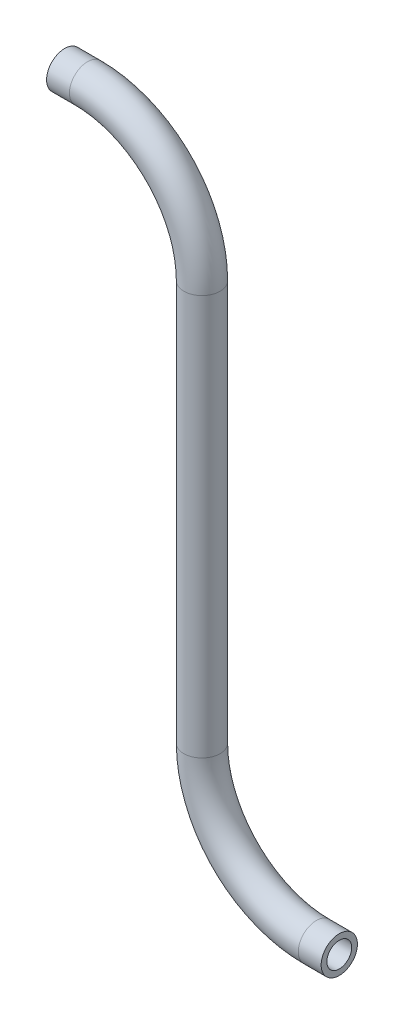
from build123d import *

# Parameters (mm, degrees)
SWEEP_SOTTILE1_PROFILE_R   = 1.585
SWEEP_SOTTILE1_PROFILE_R_2 = 1.085


with BuildPart() as part:
    # Sweep-Sottile1: sweep along a path in Schizzo1
    with BuildLine(Plane.XY) as sweep_sottile1_path:
        Line((-12, 55), (-10, 55))
        ThreePointArc((-10, 55), (-2.928932188, 52.071067812), (0, 45))
        Line((0, 45), (0, 10))
        ThreePointArc((0, 10), (2.928932188, 2.928932188), (10, 0))
        Line((10, 0), (12, 0))
    # Sweep-Sottile1 profile (on start of the path) → Sweep-Sottile1 (sweep)
    with BuildSketch(Plane(origin=(-12, 55, 0), x_dir=(0, 1, 0), z_dir=(1, 0, 0))):
        Circle(SWEEP_SOTTILE1_PROFILE_R)
        Circle(SWEEP_SOTTILE1_PROFILE_R_2, mode=Mode.SUBTRACT)
    sweep(path=sweep_sottile1_path.line)


solid = part.part
